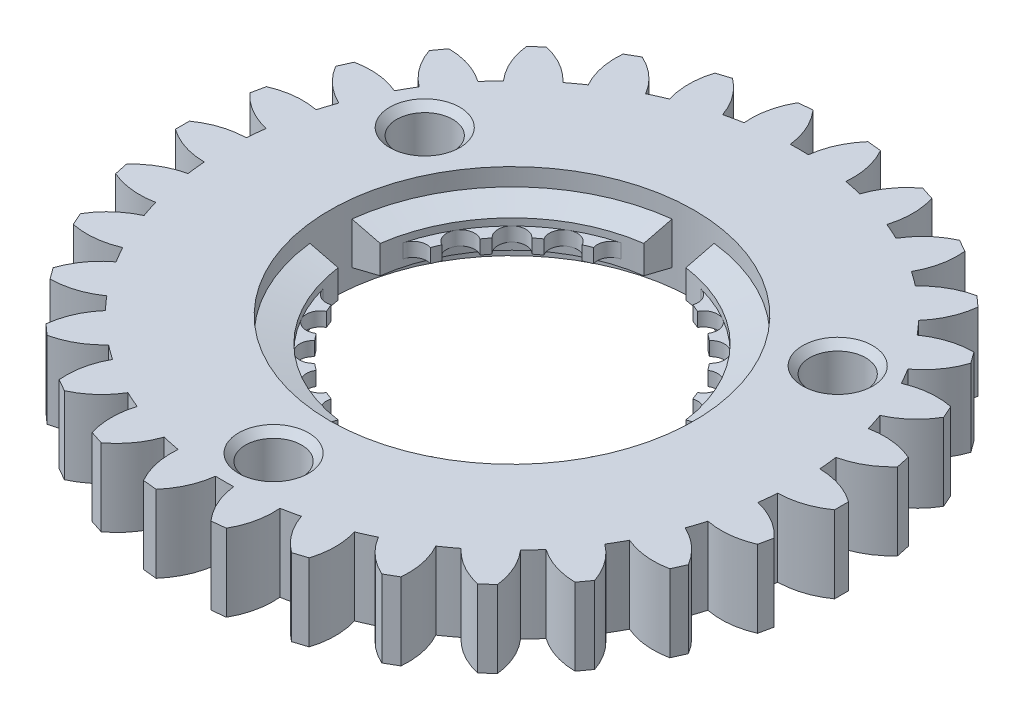
from build123d import *
from build123d.topology import SkipClean

# Parameters (mm, degrees)
SKETCH_1_R          = 20.5
EXTRUDE_1_DEPTH     = 5.5
EXTRUDE_2_DEPTH     = 5.5
SKETCH_3_R          = 13
CUT_EXTRUDE_1_DEPTH = 1.25
CUT_EXTRUDE_START   = -1.25
SKETCH_4_R          = 13
CUT_EXTRUDE_2_DEPTH = 1.25
SKETCH_6_R          = 11
CUT_EXTRUDE_3_DEPTH = 0.5
CUT_EXTRUDE_START_2 = -0.5
SKETCH_7_R          = 11
CUT_EXTRUDE_4_DEPTH = 0.5
SKETCH_8_R          = 10
CUT_EXTRUDE_5_DEPTH = 34.338779224
SKETCH_10_R         = 1
CUT_EXTRUDE_6_DEPTH = 34.338779224
CUT_EXTRUDE_7_DEPTH = 34.632747437
SKETCH_12_R         = 2
CUT_EXTRUDE_8_DEPTH = 34.632747437
CUT_EXTRUDE_9_DEPTH = 4
CHAMFER_1_SIZE      = 0.5


with BuildPart() as part:
    # 草图1 → 凸台-拉伸1 (new body)
    with BuildSketch(Plane(origin=(0, 0, 0), x_dir=(1, 0, 0), z_dir=(0, 1, 0))):
        Circle(SKETCH_1_R)
    extrude(amount=EXTRUDE_1_DEPTH)

    # 草图2 → 凸台-拉伸2 (add)
    with BuildSketch(Plane(origin=(0, 0, 0), x_dir=(1, 0, 0), z_dir=(0, 1, 0))):
        with BuildLine():
            Line((-23.5, 0.5), (-23.5, -0.5))
            ThreePointArc((-23.5, -0.5), (-22.049175074, -1.23416487), (-20.4450483, -1.5))
            ThreePointArc((-20.4450483, -1.5), (-20.5, 0), (-20.4450483, 1.5))
            ThreePointArc((-20.4450483, 1.5), (-22.049175074, 1.23416487), (-23.5, 0.5))
        make_face()
        with BuildLine():
            Line((-22.882512772, 5.374998535), (-23.090424463, 4.396850934))
            ThreePointArc((-23.090424463, 4.396850934), (-21.823945002, 3.377085864), (-20.310142478, 2.78354316))
            ThreePointArc((-20.310142478, 2.78354316), (-20.052025815, 4.262189662), (-19.686407406, 5.717985962))
            ThreePointArc((-19.686407406, 5.717985962), (-21.310750392, 5.791476677), (-22.882512772, 5.374998535))
        make_face()
        with BuildLine():
            Line((-21.264949933, 10.015083841), (-21.671686576, 9.101538383))
            ThreePointArc((-21.671686576, 9.101538383), (-20.64490381, 7.840741741), (-19.287585971, 6.945432127))
            ThreePointArc((-19.287585971, 6.945432127), (-18.727681882, 8.338101183), (-18.067376041, 9.6860685))
            ThreePointArc((-18.067376041, 9.6860685), (-19.640943657, 10.095673163), (-21.264949933, 10.015083841))
        make_face()
        with BuildLine():
            Line((-18.718006742, 14.217461926), (-19.305791994, 13.408444932))
            ThreePointArc((-19.305791994, 13.408444932), (-18.563581256, 11.96171958), (-17.422069404, 10.803772382))
            ThreePointArc((-17.422069404, 10.803772382), (-16.584848385, 12.049597672), (-15.658713647, 13.230823365))
            ThreePointArc((-15.658713647, 13.230823365), (-17.112733437, 13.958640287), (-18.718006742, 14.217461926))
        make_face()
        with BuildLine():
            Line((-15.352996837, 17.798468702), (-16.096141662, 17.129338096))
            ThreePointArc((-16.096141662, 17.129338096), (-15.670941124, 15.559912874), (-14.795124804, 14.189935941))
            ThreePointArc((-14.795124804, 14.189935941), (-13.71717743, 15.234468922), (-12.565690328, 16.197327761))
            ThreePointArc((-12.565690328, 16.197327761), (-13.83661465, 17.21154785), (-15.352996837, 17.798468702))
        make_face()
        with BuildLine():
            Line((-11.316987298, 20.601596989), (-12.183012702, 20.101596989))
            ThreePointArc((-12.183012702, 20.101596989), (-12.093405667, 18.478063312), (-11.521562256, 16.95593121))
            ThreePointArc((-11.521562256, 16.95593121), (-10.25, 17.753520778), (-8.923486044, 18.45593121))
            ThreePointArc((-8.923486044, 18.45593121), (-9.955769407, 19.712228182), (-11.316987298, 20.601596989))
        make_face()
        with BuildLine():
            Line((-6.78637111, 22.50433663), (-7.737427626, 22.195319636))
            ThreePointArc((-7.737427626, 22.195319636), (-7.987330352, 20.588633714), (-7.74445215, 18.98087092))
            ThreePointArc((-7.74445215, 18.98087092), (-6.334848385, 19.496658584), (-4.891282601, 19.907921903))
            ThreePointArc((-4.891282601, 19.907921903), (-5.639809268, 21.351389552), (-6.78637111, 22.50433663))
        make_face()
        with BuildLine():
            Line((-1.959157939, 23.423528773), (-2.953679834, 23.31900031))
            ThreePointArc((-2.953679834, 23.31900031), (-3.532170373, 21.799382029), (-3.628872323, 20.176255492))
            ThreePointArc((-3.628872323, 20.176255492), (-2.142833497, 20.387698855), (-0.645306637, 20.489840881))
            ThreePointArc((-0.645306637, 20.489840881), (-1.077362401, 22.057392743), (-1.959157939, 23.423528773))
        make_face()
        with BuildLine():
            Line((2.953679834, 23.31900031), (1.959157939, 23.423528773))
            ThreePointArc((1.959157939, 23.423528773), (1.077362401, 22.057392743), (0.645306637, 20.489840881))
            ThreePointArc((0.645306637, 20.489840881), (2.142833497, 20.387698855), (3.628872323, 20.176255492))
            ThreePointArc((3.628872323, 20.176255492), (3.532170373, 21.799382029), (2.953679834, 23.31900031))
        make_face()
        with BuildLine():
            Line((7.737427626, 22.195319636), (6.78637111, 22.50433663))
            ThreePointArc((6.78637111, 22.50433663), (5.639809268, 21.351389552), (4.891282601, 19.907921903))
            ThreePointArc((4.891282601, 19.907921903), (6.334848385, 19.496658584), (7.74445215, 18.98087092))
            ThreePointArc((7.74445215, 18.98087092), (7.987330352, 20.588633714), (7.737427626, 22.195319636))
        make_face()
        with BuildLine():
            Line((12.183012702, 20.101596989), (11.316987298, 20.601596989))
            ThreePointArc((11.316987298, 20.601596989), (9.955769407, 19.712228182), (8.923486044, 18.45593121))
            ThreePointArc((8.923486044, 18.45593121), (10.25, 17.753520778), (11.521562256, 16.95593121))
            ThreePointArc((11.521562256, 16.95593121), (12.093405667, 18.478063312), (12.183012702, 20.101596989))
        make_face()
        with BuildLine():
            Line((16.096141662, 17.129338096), (15.352996837, 17.798468702))
            ThreePointArc((15.352996837, 17.798468702), (13.83661465, 17.21154785), (12.565690328, 16.197327761))
            ThreePointArc((12.565690328, 16.197327761), (13.71717743, 15.234468922), (14.795124804, 14.189935941))
            ThreePointArc((14.795124804, 14.189935941), (15.670941124, 15.559912874), (16.096141662, 17.129338096))
        make_face()
        with BuildLine():
            Line((19.305791994, 13.408444932), (18.718006742, 14.217461926))
            ThreePointArc((18.718006742, 14.217461926), (17.112733437, 13.958640287), (15.658713647, 13.230823365))
            ThreePointArc((15.658713647, 13.230823365), (16.584848385, 12.049597672), (17.422069404, 10.803772382))
            ThreePointArc((17.422069404, 10.803772382), (18.563581256, 11.96171958), (19.305791994, 13.408444932))
        make_face()
        with BuildLine():
            Line((21.671686576, 9.101538383), (21.264949933, 10.015083841))
            ThreePointArc((21.264949933, 10.015083841), (19.640943657, 10.095673163), (18.067376041, 9.6860685))
            ThreePointArc((18.067376041, 9.6860685), (18.727681882, 8.338101183), (19.287585971, 6.945432127))
            ThreePointArc((19.287585971, 6.945432127), (20.64490381, 7.840741741), (21.671686576, 9.101538383))
        make_face()
        with BuildLine():
            Line((23.090424463, 4.396850934), (22.882512772, 5.374998535))
            ThreePointArc((22.882512772, 5.374998535), (21.310750392, 5.791476677), (19.686407406, 5.717985962))
            ThreePointArc((19.686407406, 5.717985962), (20.052025815, 4.262189662), (20.310142478, 2.78354316))
            ThreePointArc((20.310142478, 2.78354316), (21.823945002, 3.377085864), (23.090424463, 4.396850934))
        make_face()
        with BuildLine():
            Line((23.5, -0.5), (23.5, 0.5))
            ThreePointArc((23.5, 0.5), (22.049175074, 1.23416487), (20.4450483, 1.5))
            ThreePointArc((20.4450483, 1.5), (20.5, 0), (20.4450483, -1.5))
            ThreePointArc((20.4450483, -1.5), (22.049175074, -1.23416487), (23.5, -0.5))
        make_face()
        with BuildLine():
            Line((22.882512772, -5.374998535), (23.090424463, -4.396850934))
            ThreePointArc((23.090424463, -4.396850934), (21.823945002, -3.377085864), (20.310142478, -2.78354316))
            ThreePointArc((20.310142478, -2.78354316), (20.052025815, -4.262189662), (19.686407406, -5.717985962))
            ThreePointArc((19.686407406, -5.717985962), (21.310750392, -5.791476677), (22.882512772, -5.374998535))
        make_face()
        with BuildLine():
            Line((21.264949933, -10.015083841), (21.671686576, -9.101538383))
            ThreePointArc((21.671686576, -9.101538383), (20.64490381, -7.840741741), (19.287585971, -6.945432127))
            ThreePointArc((19.287585971, -6.945432127), (18.727681882, -8.338101183), (18.067376041, -9.6860685))
            ThreePointArc((18.067376041, -9.6860685), (19.640943657, -10.095673163), (21.264949933, -10.015083841))
        make_face()
        with BuildLine():
            Line((18.718006742, -14.217461926), (19.305791994, -13.408444932))
            ThreePointArc((19.305791994, -13.408444932), (18.563581256, -11.96171958), (17.422069404, -10.803772382))
            ThreePointArc((17.422069404, -10.803772382), (16.584848385, -12.049597672), (15.658713647, -13.230823365))
            ThreePointArc((15.658713647, -13.230823365), (17.112733437, -13.958640287), (18.718006742, -14.217461926))
        make_face()
        with BuildLine():
            Line((15.352996837, -17.798468702), (16.096141662, -17.129338096))
            ThreePointArc((16.096141662, -17.129338096), (15.670941124, -15.559912874), (14.795124804, -14.189935941))
            ThreePointArc((14.795124804, -14.189935941), (13.71717743, -15.234468922), (12.565690328, -16.197327761))
            ThreePointArc((12.565690328, -16.197327761), (13.83661465, -17.21154785), (15.352996837, -17.798468702))
        make_face()
        with BuildLine():
            Line((11.316987298, -20.601596989), (12.183012702, -20.101596989))
            ThreePointArc((12.183012702, -20.101596989), (12.093405667, -18.478063312), (11.521562256, -16.95593121))
            ThreePointArc((11.521562256, -16.95593121), (10.25, -17.753520778), (8.923486044, -18.45593121))
            ThreePointArc((8.923486044, -18.45593121), (9.955769407, -19.712228182), (11.316987298, -20.601596989))
        make_face()
        with BuildLine():
            Line((6.78637111, -22.50433663), (7.737427626, -22.195319636))
            ThreePointArc((7.737427626, -22.195319636), (7.987330352, -20.588633714), (7.74445215, -18.98087092))
            ThreePointArc((7.74445215, -18.98087092), (6.334848385, -19.496658584), (4.891282601, -19.907921903))
            ThreePointArc((4.891282601, -19.907921903), (5.639809268, -21.351389552), (6.78637111, -22.50433663))
        make_face()
        with BuildLine():
            Line((1.959157939, -23.423528773), (2.953679834, -23.31900031))
            ThreePointArc((2.953679834, -23.31900031), (3.532170373, -21.799382029), (3.628872323, -20.176255492))
            ThreePointArc((3.628872323, -20.176255492), (2.142833497, -20.387698855), (0.645306637, -20.489840881))
            ThreePointArc((0.645306637, -20.489840881), (1.077362401, -22.057392743), (1.959157939, -23.423528773))
        make_face()
        with BuildLine():
            Line((-2.953679834, -23.31900031), (-1.959157939, -23.423528773))
            ThreePointArc((-1.959157939, -23.423528773), (-1.077362401, -22.057392743), (-0.645306637, -20.489840881))
            ThreePointArc((-0.645306637, -20.489840881), (-2.142833497, -20.387698855), (-3.628872323, -20.176255492))
            ThreePointArc((-3.628872323, -20.176255492), (-3.532170373, -21.799382029), (-2.953679834, -23.31900031))
        make_face()
        with BuildLine():
            Line((-7.737427626, -22.195319636), (-6.78637111, -22.50433663))
            ThreePointArc((-6.78637111, -22.50433663), (-5.639809268, -21.351389552), (-4.891282601, -19.907921903))
            ThreePointArc((-4.891282601, -19.907921903), (-6.334848385, -19.496658584), (-7.74445215, -18.98087092))
            ThreePointArc((-7.74445215, -18.98087092), (-7.987330352, -20.588633714), (-7.737427626, -22.195319636))
        make_face()
        with BuildLine():
            Line((-12.183012702, -20.101596989), (-11.316987298, -20.601596989))
            ThreePointArc((-11.316987298, -20.601596989), (-9.955769407, -19.712228182), (-8.923486044, -18.45593121))
            ThreePointArc((-8.923486044, -18.45593121), (-10.25, -17.753520778), (-11.521562256, -16.95593121))
            ThreePointArc((-11.521562256, -16.95593121), (-12.093405667, -18.478063312), (-12.183012702, -20.101596989))
        make_face()
        with BuildLine():
            Line((-16.096141662, -17.129338096), (-15.352996837, -17.798468702))
            ThreePointArc((-15.352996837, -17.798468702), (-13.83661465, -17.21154785), (-12.565690328, -16.197327761))
            ThreePointArc((-12.565690328, -16.197327761), (-13.71717743, -15.234468922), (-14.795124804, -14.189935941))
            ThreePointArc((-14.795124804, -14.189935941), (-15.670941124, -15.559912874), (-16.096141662, -17.129338096))
        make_face()
        with BuildLine():
            Line((-19.305791994, -13.408444932), (-18.718006742, -14.217461926))
            ThreePointArc((-18.718006742, -14.217461926), (-17.112733437, -13.958640287), (-15.658713647, -13.230823365))
            ThreePointArc((-15.658713647, -13.230823365), (-16.584848385, -12.049597672), (-17.422069404, -10.803772382))
            ThreePointArc((-17.422069404, -10.803772382), (-18.563581256, -11.96171958), (-19.305791994, -13.408444932))
        make_face()
        with BuildLine():
            Line((-21.671686576, -9.101538383), (-21.264949933, -10.015083841))
            ThreePointArc((-21.264949933, -10.015083841), (-19.640943657, -10.095673163), (-18.067376041, -9.6860685))
            ThreePointArc((-18.067376041, -9.6860685), (-18.727681882, -8.338101183), (-19.287585971, -6.945432127))
            ThreePointArc((-19.287585971, -6.945432127), (-20.64490381, -7.840741741), (-21.671686576, -9.101538383))
        make_face()
        with BuildLine():
            Line((-23.090424463, -4.396850934), (-22.882512772, -5.374998535))
            ThreePointArc((-22.882512772, -5.374998535), (-21.310750392, -5.791476677), (-19.686407406, -5.717985962))
            ThreePointArc((-19.686407406, -5.717985962), (-20.052025815, -4.262189662), (-20.310142478, -2.78354316))
            ThreePointArc((-20.310142478, -2.78354316), (-21.823945002, -3.377085864), (-23.090424463, -4.396850934))
        make_face()
    extrude(amount=EXTRUDE_2_DEPTH)

    # 草图3 → 切除-拉伸1 (cut)
    with BuildSketch(Plane(origin=(0, 5.5, 0), x_dir=(1, 0, 0), z_dir=(0, 1, 0))):
        Circle(SKETCH_3_R)
    extrude(amount=-CUT_EXTRUDE_1_DEPTH, mode=Mode.SUBTRACT)

    # 草图4 → 切除-拉伸2 (cut)
    with BuildSketch(Plane.XZ.offset(CUT_EXTRUDE_START)):
        Circle(SKETCH_4_R)
    extrude(amount=CUT_EXTRUDE_2_DEPTH, mode=Mode.SUBTRACT)

    # 草图5 → 切除-旋转1 (revolve, cut)
    with BuildSketch(Plane.XY):
        Polygon((-13, 4.25), (-11, 3.75), (0, 3.75), (0, 4.25), align=None)
        Polygon((-13, 1.25), (-11, 1.75), (0, 1.75), (0, 1.25), align=None)
    revolve(axis=Axis((0, 2.75, 0), (0, -1, 0)), mode=Mode.SUBTRACT)

    # 草图6 → 切除-拉伸3 (cut)
    with BuildSketch(Plane(origin=(0, 3.75, 0), x_dir=(1, 0, 0), z_dir=(0, 1, 0))):
        Circle(SKETCH_6_R)
    extrude(amount=-CUT_EXTRUDE_3_DEPTH, mode=Mode.SUBTRACT)

    # 草图7 → 切除-拉伸4 (cut)
    with BuildSketch(Plane.XZ.offset(-1.75).offset(CUT_EXTRUDE_START_2)):
        Circle(SKETCH_7_R)
    extrude(amount=CUT_EXTRUDE_4_DEPTH, mode=Mode.SUBTRACT)

    # 草图8 → 切除-拉伸5 (cut, through all)
    with BuildSketch(Plane.XZ.offset(-2.25)):
        Circle(SKETCH_8_R)
    extrude(amount=-CUT_EXTRUDE_5_DEPTH, mode=Mode.SUBTRACT)

    # 草图10 → 切除-拉伸6 (cut, through all)
    with SkipClean():  # the faces are left unmerged after this step: merging them gives an invalid solid
        with BuildSketch(Plane.XZ.offset(-2.25)):
            with Locations((-5, -8.660254038)):
                Circle(SKETCH_10_R)
            with Locations((-7.071067812, -7.071067812)):
                Circle(SKETCH_10_R)
            with Locations((-8.660254038, -5)):
                Circle(SKETCH_10_R)
            with Locations((-8.660254038, 5)):
                Circle(SKETCH_10_R)
            with Locations((-7.071067812, 7.071067812)):
                Circle(SKETCH_10_R)
            with Locations((-5, 8.660254038)):
                Circle(SKETCH_10_R)
            with Locations((5, 8.660254038)):
                Circle(SKETCH_10_R)
            with Locations((7.071067812, 7.071067812)):
                Circle(SKETCH_10_R)
            with Locations((8.660254038, 5)):
                Circle(SKETCH_10_R)
            with Locations((8.660254038, -5)):
                Circle(SKETCH_10_R)
            with Locations((7.071067812, -7.071067812)):
                Circle(SKETCH_10_R)
            with Locations((5, -8.660254038)):
                Circle(SKETCH_10_R)
            with BuildLine():
                ThreePointArc((3.539967162, -9.352466653), (0, -10), (-3.539967162, -9.352466653))
                ThreePointArc((-3.539967162, -9.352466653), (-3.466448921, -10.137444482), (-2.847009496, -10.625184089))
                ThreePointArc((-2.847009496, -10.625184089), (0, -11), (2.847009496, -10.625184089))
                ThreePointArc((2.847009496, -10.625184089), (3.466448921, -10.137444482), (3.539967162, -9.352466653))
            make_face()
            with BuildLine():
                ThreePointArc((-9.352466653, -3.539967162), (-10, 0), (-9.352466653, 3.539967162))
                ThreePointArc((-9.352466653, 3.539967162), (-10.137444482, 3.466448921), (-10.625184089, 2.847009496))
                ThreePointArc((-10.625184089, 2.847009496), (-11, 0), (-10.625184089, -2.847009496))
                ThreePointArc((-10.625184089, -2.847009496), (-10.137444482, -3.466448921), (-9.352466653, -3.539967162))
            make_face()
            with BuildLine():
                ThreePointArc((-3.539967162, 9.352466653), (0, 10), (3.539967162, 9.352466653))
                ThreePointArc((3.539967162, 9.352466653), (3.466448921, 10.137444482), (2.847009496, 10.625184089))
                ThreePointArc((2.847009496, 10.625184089), (0, 11), (-2.847009496, 10.625184089))
                ThreePointArc((-2.847009496, 10.625184089), (-3.466448921, 10.137444482), (-3.539967162, 9.352466653))
            make_face()
            with BuildLine():
                ThreePointArc((9.352466653, 3.539967162), (10, 0), (9.352466653, -3.539967162))
                ThreePointArc((9.352466653, -3.539967162), (10.137444482, -3.466448921), (10.625184089, -2.847009496))
                ThreePointArc((10.625184089, -2.847009496), (11, 0), (10.625184089, 2.847009496))
                ThreePointArc((10.625184089, 2.847009496), (10.137444482, 3.466448921), (9.352466653, 3.539967162))
            make_face()
        extrude(amount=-CUT_EXTRUDE_6_DEPTH, mode=Mode.SUBTRACT)

    # 草图11 → 切除-拉伸7 (cut, through all)
    with SkipClean():  # the faces are left unmerged after this step: merging them gives an invalid solid
        with BuildSketch(Plane.XZ):
            with BuildLine():
                Line((-1.5, 12.91317157), (-1.5, 10.897247359))
                ThreePointArc((-1.5, 10.897247359), (0, 11), (1.5, 10.897247359))
                Line((1.5, 10.897247359), (1.5, 12.91317157))
                ThreePointArc((1.5, 12.91317157), (0, 13), (-1.5, 12.91317157))
            make_face()
            with BuildLine():
                Line((12.91317157, 1.5), (10.897247359, 1.5))
                ThreePointArc((10.897247359, 1.5), (11, 0), (10.897247359, -1.5))
                Line((10.897247359, -1.5), (12.91317157, -1.5))
                ThreePointArc((12.91317157, -1.5), (13, 0), (12.91317157, 1.5))
            make_face()
            with BuildLine():
                Line((1.5, -12.91317157), (1.5, -10.897247359))
                ThreePointArc((1.5, -10.897247359), (0, -11), (-1.5, -10.897247359))
                Line((-1.5, -10.897247359), (-1.5, -12.91317157))
                ThreePointArc((-1.5, -12.91317157), (0, -13), (1.5, -12.91317157))
            make_face()
            with BuildLine():
                Line((-12.91317157, -1.5), (-10.897247359, -1.5))
                ThreePointArc((-10.897247359, -1.5), (-11, 0), (-10.897247359, 1.5))
                Line((-10.897247359, 1.5), (-12.91317157, 1.5))
                ThreePointArc((-12.91317157, 1.5), (-13, 0), (-12.91317157, -1.5))
            make_face()
        extrude(amount=-CUT_EXTRUDE_7_DEPTH, mode=Mode.SUBTRACT)
    add(part.part.scale(1), mode=Mode.REPLACE)  # the faces are merged on a copy

    # 草图12 → 切除-拉伸8 (cut, through all)
    with BuildSketch(Plane.XZ):
        with Locations((0, 17)):
            Circle(SKETCH_12_R)
        with Locations((14.722431864, -8.5)):
            Circle(SKETCH_12_R)
        with Locations((-14.722431864, -8.5)):
            Circle(SKETCH_12_R)
    extrude(amount=-CUT_EXTRUDE_8_DEPTH, mode=Mode.SUBTRACT)

    # 草图13 → 切除-拉伸9 (cut)
    with BuildSketch(Plane.XZ):
        with BuildLine():
            ThreePointArc((14.855579921, -2.076474227), (12.990381057, 7.5), (5.62951053, 13.903546713))
            ThreePointArc((5.62951053, 13.903546713), (4.526305705, 16.507954345), (7.130713338, 17.61115917))
            ThreePointArc((7.130713338, 17.61115917), (16.454482672, 9.5), (18.8170679, -2.630200687))
            ThreePointArc((18.8170679, -2.630200687), (16.55946068, -4.334081446), (14.855579921, -2.076474227))
        make_face()
        with BuildLine():
            ThreePointArc((-9.226069391, -11.827072486), (0, -15), (9.226069391, -11.827072486))
            ThreePointArc((9.226069391, -11.827072486), (12.033154975, -12.173872899), (11.686354562, -14.980958482))
            ThreePointArc((11.686354562, -14.980958482), (0, -19), (-11.686354562, -14.980958482))
            ThreePointArc((-11.686354562, -14.980958482), (-12.033154975, -12.173872899), (-9.226069391, -11.827072486))
        make_face()
        with BuildLine():
            ThreePointArc((-5.62951053, 13.903546713), (-12.990381057, 7.5), (-14.855579921, -2.076474227))
            ThreePointArc((-14.855579921, -2.076474227), (-16.55946068, -4.334081446), (-18.8170679, -2.630200687))
            ThreePointArc((-18.8170679, -2.630200687), (-16.454482672, 9.5), (-7.130713338, 17.61115917))
            ThreePointArc((-7.130713338, 17.61115917), (-4.526305705, 16.507954345), (-5.62951053, 13.903546713))
        make_face()
    extrude(amount=-CUT_EXTRUDE_9_DEPTH, mode=Mode.SUBTRACT)

    # 倒角1
    chamfer_1_edges = [part.edges().sort_by_distance(p)[0] for p in [
        (-16.722431864, 5.5, -8.5),
        (12.722431864, 5.5, -8.5),
        (-2, 5.5, 17),
        (12.722431864, 0, -8.5),
        (-16.722431864, 0, -8.5),
        (-2, 0, 17),
    ]]
    chamfer(chamfer_1_edges, length=CHAMFER_1_SIZE)


solid = part.part
